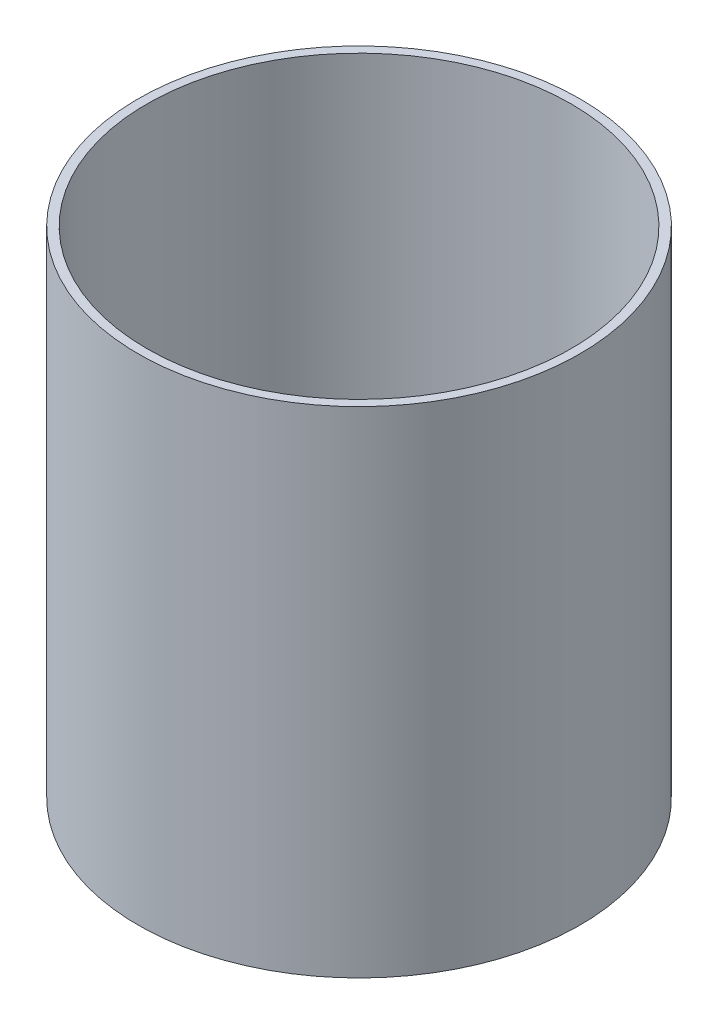
from build123d import *

# Parameters (mm, degrees)
SKETCH1_R           = 1250
SKETCH1_R_2         = 1200
BOSS_EXTRUDE1_DEPTH = 2800.000000116


with BuildPart() as part:
    # Sketch1 → Boss-Extrude1 (new body)
    with BuildSketch(Plane(origin=(0, 0, 0), x_dir=(1, 0, 0), z_dir=(0, 1, 0))):
        Circle(SKETCH1_R)
        Circle(SKETCH1_R_2, mode=Mode.SUBTRACT)
    extrude(amount=BOSS_EXTRUDE1_DEPTH)


solid = part.part
